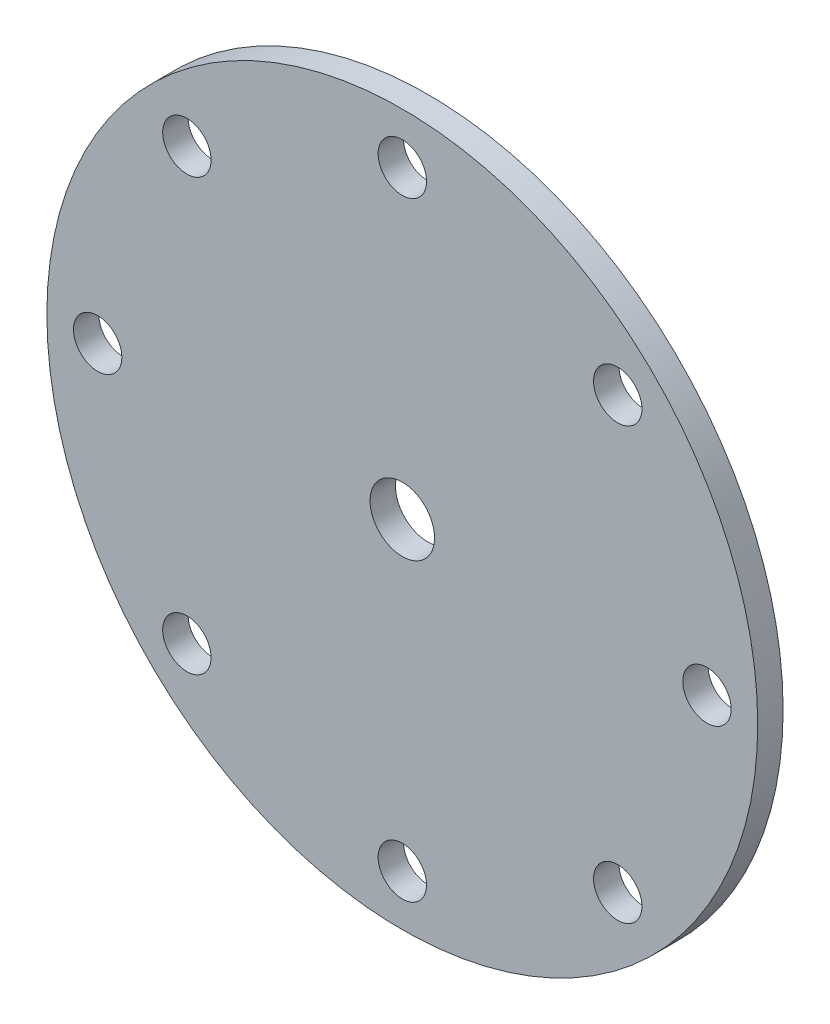
from build123d import *

# Parameters (mm, degrees)
SKETCH1_R        = 70
SKETCH1_R_2      = 4.7625
SKETCH1_R_3      = 6.35
ROTOR_DISC_DEPTH = 5


with BuildPart() as part:
    # Sketch1 → Rotor Disc (new body)
    with BuildSketch(Plane.XY):
        Circle(SKETCH1_R)
        with Locations((-42.426406871, -42.426406871)):
            Circle(SKETCH1_R_2, mode=Mode.SUBTRACT)
        with Locations((-60, 0)):
            Circle(SKETCH1_R_2, mode=Mode.SUBTRACT)
        with Locations((0, -60)):
            Circle(SKETCH1_R_2, mode=Mode.SUBTRACT)
        with Locations((42.426406871, -42.426406871)):
            Circle(SKETCH1_R_2, mode=Mode.SUBTRACT)
        with Locations((-42.426406871, 42.426406871)):
            Circle(SKETCH1_R_2, mode=Mode.SUBTRACT)
        Circle(SKETCH1_R_3, mode=Mode.SUBTRACT)
        with Locations((60, 0)):
            Circle(SKETCH1_R_2, mode=Mode.SUBTRACT)
        with Locations((0, 60)):
            Circle(SKETCH1_R_2, mode=Mode.SUBTRACT)
        with Locations((42.426406871, 42.426406871)):
            Circle(SKETCH1_R_2, mode=Mode.SUBTRACT)
    extrude(amount=ROTOR_DISC_DEPTH)


solid = part.part
